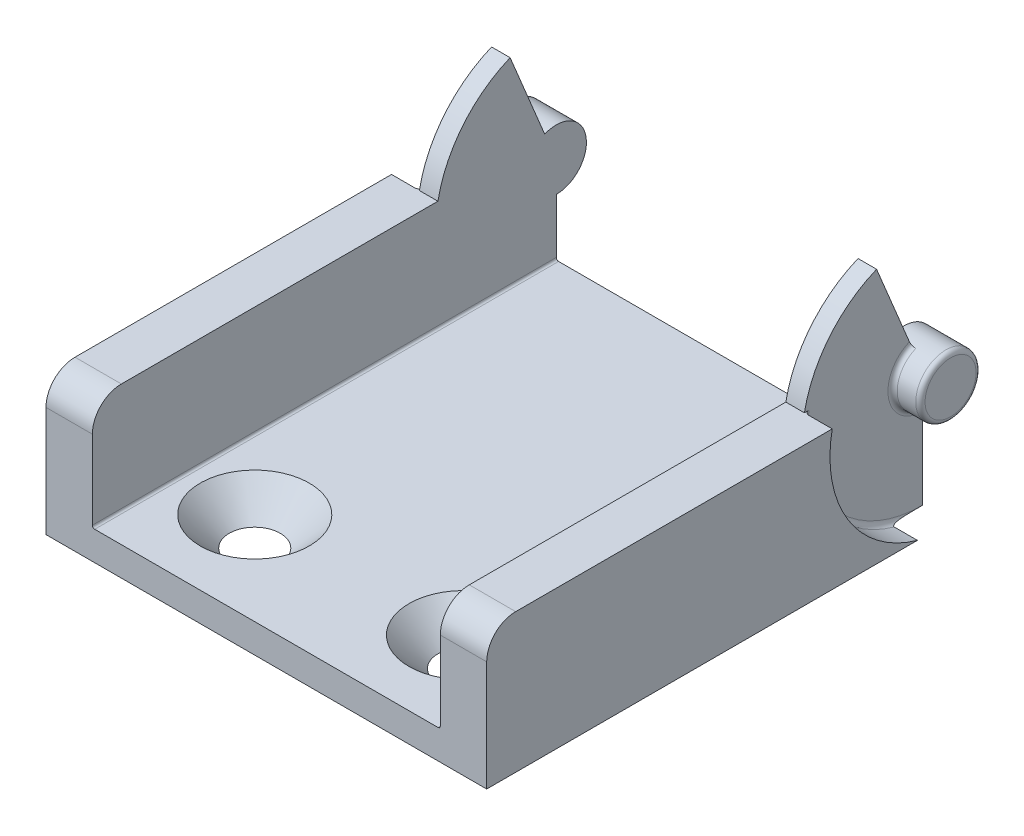
from build123d import *

# Parameters (mm, degrees)
BOSS_EXTRUDE5_DEPTH             = 19
CUT_EXTRUDE1_DEPTH              = 2.4
BOSS_EXTRUDE4_REACH             = 47.398
SKETCH5_R                       = 2.6
BOSS_EXTRUDE4_DIRECTION_2_REACH = 47.398
CUT_EXTRUDE3_DEPTH              = 48.70492637
CUT_EXTRUDE3_DEPTH_BACK         = 48.70492637
FILLET17_R                      = 0.4
FILLET_1_R                      = 2.5
HOLE_WIZARD_M41_D               = 4.2
HOLE_WIZARD_M41_DEPTH           = 8.5
HOLE_WIZARD_M41_CSINK_D         = 9.4
HOLE_WIZARD_M41_CSINK_ANGLE     = 90
HOLE_WIZARD_M41_TIP             = 1.2618073


with BuildPart() as part:
    # Sketch8 → Boss-Extrude5 (new, symmetric)
    with BuildSketch(Plane(origin=(0, 0, 0), x_dir=(0, 0, -1), z_dir=(1, 0, 0))):
        with BuildLine():
            Line((0, 2), (0, -10))
            Line((0, -10), (40, -10))
            Line((40, -10), (40, 0))
            Line((40, 0), (36.020092303, 9.608347138))
            ThreePointArc((36.020092303, 9.608347138), (31.951342699, 6.586282384), (29.794119342, 2))
            Line((29.794119342, 2), (0, 2))
        make_face()
    extrude(amount=BOSS_EXTRUDE5_DEPTH, both=True)

    # Sketch4 → Cut-Extrude1 (cut)
    with BuildSketch(Plane(origin=(19, 0, 0), x_dir=(0, 0, -1), z_dir=(1, 0, 0))):
        with BuildLine():
            Line((32.646089476, 7.353910524), (50.4, 25.107821049))
            Line((50.4, 25.107821049), (50.4, 0))
            ThreePointArc((50.4, 0), (36.020092303, -9.608347138), (32.646089476, 7.353910524))
        make_face()
    cut_extrude1 = extrude(amount=-CUT_EXTRUDE1_DEPTH, mode=Mode.SUBTRACT)

    # Mirror1: Cut-Extrude1 across plane
    add(cut_extrude1.mirror(Plane(origin=(0, 0, 0), x_dir=(0, 0, 1), z_dir=(1, 0, 0))), mode=Mode.SUBTRACT)

    # Boss-Extrude4: up to this face of the body (flat: up to its plane)
    boss_extrude4_end = Plane(part.part.faces().sort_by_distance((19, -4.194169539, -15.691958581))[0])
    # Sketch5 → Boss-Extrude4 (add, up to the picked face)
    with BuildSketch(Plane(origin=(0, 0, 0), x_dir=(0, 0, -1), z_dir=(1, 0, 0)), mode=Mode.PRIVATE) as boss_extrude4_sk1:
        with Locations((40, 0)):
            Circle(SKETCH5_R)
    boss_extrude4_tool1 = split(extrude(boss_extrude4_sk1.sketch, amount=BOSS_EXTRUDE4_REACH, mode=Mode.PRIVATE), bisect_by=boss_extrude4_end, keep=Keep.BOTH, mode=Mode.PRIVATE)
    add(boss_extrude4_tool1.solids().sort_by(Axis((0, 0, -40), (1, 0, 0)))[0])

    # Boss-Extrude4 direction 2: up to this face of the body (flat: up to its plane)
    boss_extrude4_direction_2_end = Plane(part.part.faces().sort_by_distance((-19, -4.194169539, -15.691958581))[0])
    # Sketch5 → Boss-Extrude4 direction 2 (add, up to the picked face)
    with BuildSketch(Plane(origin=(0, 0, 0), x_dir=(0, 0, -1), z_dir=(1, 0, 0)), mode=Mode.PRIVATE) as boss_extrude4_direction_2_sk1:
        with Locations((40, 0)):
            Circle(SKETCH5_R)
    boss_extrude4_direction_2_tool1 = split(extrude(boss_extrude4_direction_2_sk1.sketch, amount=-BOSS_EXTRUDE4_DIRECTION_2_REACH, mode=Mode.PRIVATE), bisect_by=boss_extrude4_direction_2_end, keep=Keep.BOTH, mode=Mode.PRIVATE)
    add(boss_extrude4_direction_2_tool1.solids().sort_by(Axis((0, 0, -40), (-1, 0, 0)))[0])

    # Sketch7 → Cut-Extrude3 (cut, two sides: drawn at the far end of the back side and taken through both)
    with BuildSketch(Plane.XY.offset(-CUT_EXTRUDE3_DEPTH_BACK)):
        with BuildLine():
            Line((-14.8, -7.5), (14.8, -7.5))
            ThreePointArc((14.8, -7.5), (14.941421356, -7.441421356), (15, -7.3))
            Line((15, -7.3), (15, 12.3))
            ThreePointArc((15, 12.3), (14.941421356, 12.441421356), (14.8, 12.5))
            Line((14.8, 12.5), (-14.8, 12.5))
            ThreePointArc((-14.8, 12.5), (-14.941421356, 12.441421356), (-15, 12.3))
            Line((-15, 12.3), (-15, -7.3))
            ThreePointArc((-15, -7.3), (-14.941421356, -7.441421356), (-14.8, -7.5))
        make_face()
    extrude(amount=CUT_EXTRUDE3_DEPTH + CUT_EXTRUDE3_DEPTH_BACK, mode=Mode.SUBTRACT)

    # Fillet17
    fillet17_edges = [part.edges().sort_by_distance(p)[0] for p in [
        (-19, 0, -37.4),
        (19, 0, -37.4),
        (-16.6, -0.507234837, -37.449958271),
        (16.6, -0.507234837, -37.449958271),
        (16.6, -5.431674396, -31.13112672),
        (-16.6, -5.431674396, -31.13112672),
    ]]
    fillet(fillet17_edges, radius=FILLET17_R)

    # Скругление1
    fillet_1_edges = [part.edges().sort_by_distance(p)[0] for p in [
        (17, 2, 0),
        (-17, 2, 0),
    ]]
    fillet(fillet_1_edges, radius=FILLET_1_R)

    # Зенковка для винта с полупотайной головкой M41
    with Locations(Plane(origin=(-9, -7.5, -8), x_dir=(0, 0, 1), z_dir=(0, 1, 0))):
        with Locations((0, 0), (0, 18)):
            CounterSinkHole(HOLE_WIZARD_M41_D / 2, HOLE_WIZARD_M41_CSINK_D / 2, depth=HOLE_WIZARD_M41_DEPTH, counter_sink_angle=HOLE_WIZARD_M41_CSINK_ANGLE)
            with Locations((0, 0, -(HOLE_WIZARD_M41_DEPTH + HOLE_WIZARD_M41_TIP / 2))):  # 118° drill point
                Cone(0, HOLE_WIZARD_M41_D / 2, HOLE_WIZARD_M41_TIP, mode=Mode.SUBTRACT)


solid = part.part
